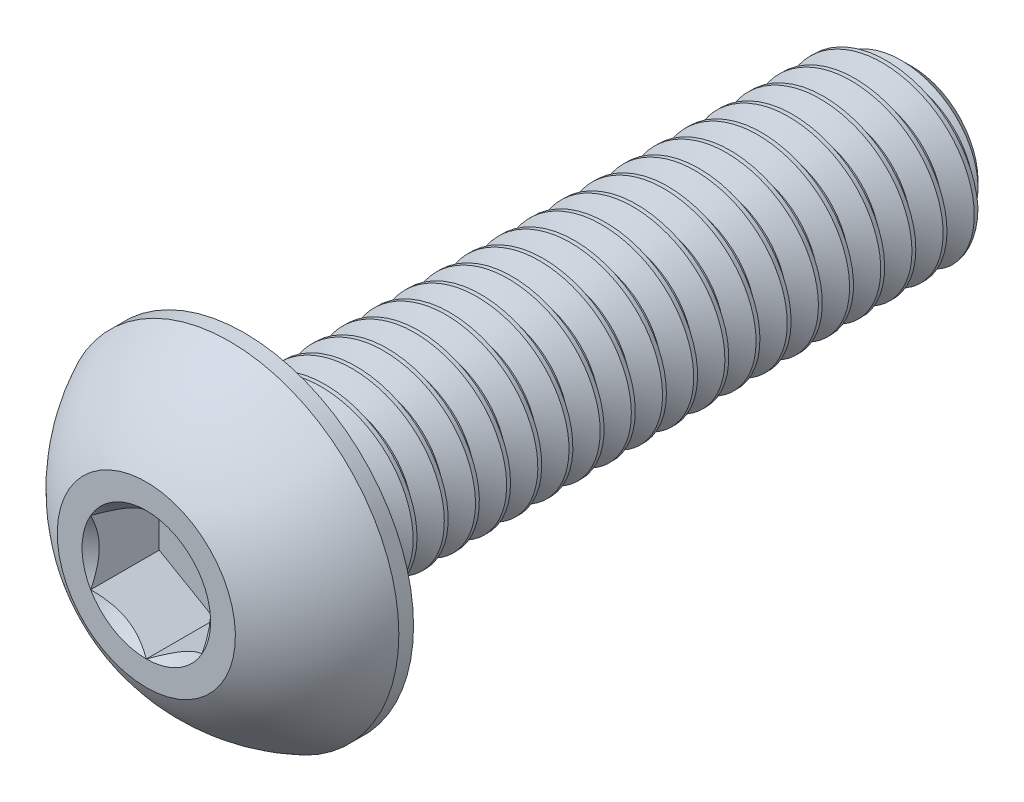
from build123d import *

# Parameters (mm, degrees)
CUT_EXTRUDE2_DEPTH = 1.54
CUT_SWEEP2_PITCH   = 0.7
CUT_SWEEP2_TO      = 15


with BuildPart() as part:
    # Sketch10 → Revolve3 (revolve)
    with BuildSketch(Plane(origin=(0, 0, 0), x_dir=(0, 0, -1), z_dir=(1, 0, 0)), mode=Mode.PRIVATE) as revolve3_sk:
        Polygon((16.675, 2), (17.2, 1.475), (17.2, 0), (2.2, 0), (2.2, 2), align=None)
    revolve(revolve3_sk.sketch.rotate(Axis((0, 0, 0), (0, 0, -1)), 90), axis=Axis((0, 0, 0), (0, 0, -1)))

    # Sketch7 → Revolve2 (revolve)
    with BuildSketch(Plane(origin=(0, 0, 0), x_dir=(0, 0, -1), z_dir=(1, 0, 0)), mode=Mode.PRIVATE) as revolve2_sk:
        with BuildLine():
            Line((1.87, 3.8), (2.2, 3.8))
            Line((2.2, 3.8), (2.2, 0))
            Line((2.2, 0), (0, 0))
            Line((0, 0), (0, 2))
            ThreePointArc((0, 2), (0.793500147, 3.047002626), (1.87, 3.8))
        make_face()
    revolve(revolve2_sk.sketch.rotate(Axis((0, 0, 0), (0, 0, -1)), 180), axis=Axis((0, 0, 0), (0, 0, -1)))

    # Sketch5 → Cut-Extrude2 (cut)
    with BuildSketch(Plane.XY):
        Polygon((1.25, -0.721687836), (1.25, 0.721687836), (0, 1.443375673), (-1.25, 0.721687836), (-1.25, -0.721687836), (0, -1.443375673), align=None)
    extrude(amount=-CUT_EXTRUDE2_DEPTH, mode=Mode.SUBTRACT)

    # Cut-Extrude3 cone 1 section (through the dimple's axis) → Cut-Extrude3 (revolve, cut)
    with BuildSketch(Plane(origin=(0, 0, 0), x_dir=(0, -1, 0), z_dir=(1, 0, 0))):
        Polygon((0, 0), (1.443375673, 0), (0, 1.443375673), align=None)
    revolve(axis=Axis((0, 0, 0), (0, 0, -1)), mode=Mode.SUBTRACT)


with BuildPart() as body_2:
    # Split1: read off the stored shape, not the designer's step
    # Split1: the piece on the far side of the plane
    add(part.part)
    split(bisect_by=Plane.XY.offset(-2.2), keep=Keep.BOTTOM)

    # Cut-Sweep2: arcs per turn and ends read off the stored shape
    # Cut-Sweep2: the profile of Sketch12 screwed along a right-hand helix through 25.666667 turns, 6 arcs to a turn; built about Z, then put on its axis
    cut_sweep2_z = Axis((0, 0, 0), (0, 0, 1))
    cut_sweep2_corners = [(1.545336663, 0, -0.2625), (1.545336663, 0, -0.35), (2.037888611, 0, -0.634375), (2.037888611, 0, 0.021875)]
    with BuildLine(mode=Mode.PRIVATE) as cut_sweep2_profile:
        Line(cut_sweep2_corners[0], cut_sweep2_corners[1])
        Line(cut_sweep2_corners[1], cut_sweep2_corners[2])
        Line(cut_sweep2_corners[2], cut_sweep2_corners[3])
        Line(cut_sweep2_corners[3], cut_sweep2_corners[0])
    cut_sweep2_cap = Face(cut_sweep2_profile.wire())
    cut_sweep2_turn_angles = [0, 30, 60, 90, 120, 150, 180, 210, 240, 270, 300, 330, 360]
    cut_sweep2_turn_weights = [1, 0.8660254037844387, 1, 0.8660254037844387, 1, 0.8660254037844387, 1, 0.8660254037844387, 1, 0.8660254037844387, 1, 0.8660254037844387, 1]
    cut_sweep2_turn_rails = [Edge.make_bspline([Vector(p[0], p[1], 0).rotate(cut_sweep2_z, cut_sweep2_turn_angles[k]) / cut_sweep2_turn_weights[k] + Vector(0, 0, p[2] + CUT_SWEEP2_PITCH * cut_sweep2_turn_angles[k] / 360) for k in range(13)], [0, 0, 0, 1, 1, 2, 2, 3, 3, 4, 4, 5, 5, 6, 6, 6], 2, cut_sweep2_turn_weights) for p in cut_sweep2_corners]
    cut_sweep2_turn_sides = [Face.make_surface_from_curves(cut_sweep2_turn_rails[p[0]], cut_sweep2_turn_rails[p[1]]) for p in [(0, 1), (1, 2), (2, 3), (3, 0)]]
    cut_sweep2_last_angles = [9000, 9030, 9060, 9090, 9120, 9150, 9180, 9210, 9240]
    cut_sweep2_last_weights = [1, 0.8660254037844387, 1, 0.8660254037844387, 1, 0.8660254037844387, 1, 0.8660254037844387, 1]
    cut_sweep2_last_rails = [Edge.make_bspline([Vector(p[0], p[1], 0).rotate(cut_sweep2_z, cut_sweep2_last_angles[k]) / cut_sweep2_last_weights[k] + Vector(0, 0, p[2] + CUT_SWEEP2_PITCH * cut_sweep2_last_angles[k] / 360) for k in range(9)], [0, 0, 0, 1, 1, 2, 2, 3, 3, 4, 4, 4], 2, cut_sweep2_last_weights) for p in cut_sweep2_corners]
    cut_sweep2_last_sides = [Face.make_surface_from_curves(cut_sweep2_last_rails[p[0]], cut_sweep2_last_rails[p[1]]) for p in [(0, 1), (1, 2), (2, 3), (3, 0)]]
    cut_sweep2 = Plane(origin=(0, 0, -17.2), x_dir=(0, 1, 0), z_dir=(0, 0, 1)) * split(Solid(Shell([*[p.moved(Location((0, 0, CUT_SWEEP2_PITCH * i))) for i in range(25) for p in cut_sweep2_turn_sides], *cut_sweep2_last_sides, cut_sweep2_cap, cut_sweep2_cap.rotate(cut_sweep2_z, 9240).moved(Location((0, 0, CUT_SWEEP2_PITCH * 9240 / 360)))])), bisect_by=Plane.XY.offset(CUT_SWEEP2_TO), keep=Keep.BOTTOM, mode=Mode.PRIVATE)
    add(cut_sweep2, mode=Mode.SUBTRACT)


with BuildPart() as part_1:
    add(part.part)

    # Split1
    split(bisect_by=Plane.XY.offset(-2.2), keep=Keep.TOP)

    add(body_2.part)  # Boss-Extrude1 merges body 2
    # Boss-Extrude1 cone 1 section (through the dimple's axis) → Boss-Extrude1 (revolve)
    with BuildSketch(Plane(origin=(0, 0, -2.2), x_dir=(0, -1, 0), z_dir=(1, 0, 0))):
        Polygon((0, 0), (2, 0), (0, 2), align=None)
    revolve(axis=Axis((0, 0, -2.2), (0, 0, -1)))


solid = part_1.part
